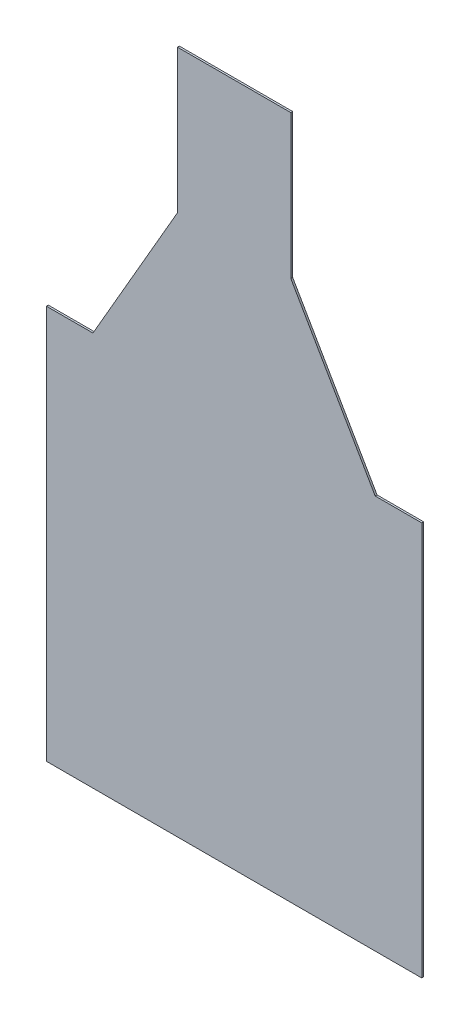
from build123d import *

# Parameters (mm, degrees)
SKETCH2_W          = 400
SKETCH2_H          = 420
BASE_FLANGE1_DEPTH = 2
TAB1_DEPTH         = 2


# Sheet-metal steps are written as plain solids
with BuildPart() as part:
    # Sketch2 → Base-Flange1 (new body)
    with BuildSketch(Plane.XY):
        with Locations((0, 28.575414969)):
            Rectangle(SKETCH2_W, SKETCH2_H)
    extrude(amount=-BASE_FLANGE1_DEPTH)

    # Sketch5 → Tab1 (add)
    with BuildSketch(Plane.XY):
        Polygon((-60.421834446, 394.376455492), (-60.421834446, 547.430628062), (60.421834446, 547.430628062), (60.421834446, 394.376455492), (150.373607132, 238.575414969), (-150.373607132, 238.575414969), align=None)
    extrude(amount=-TAB1_DEPTH)


solid = part.part
